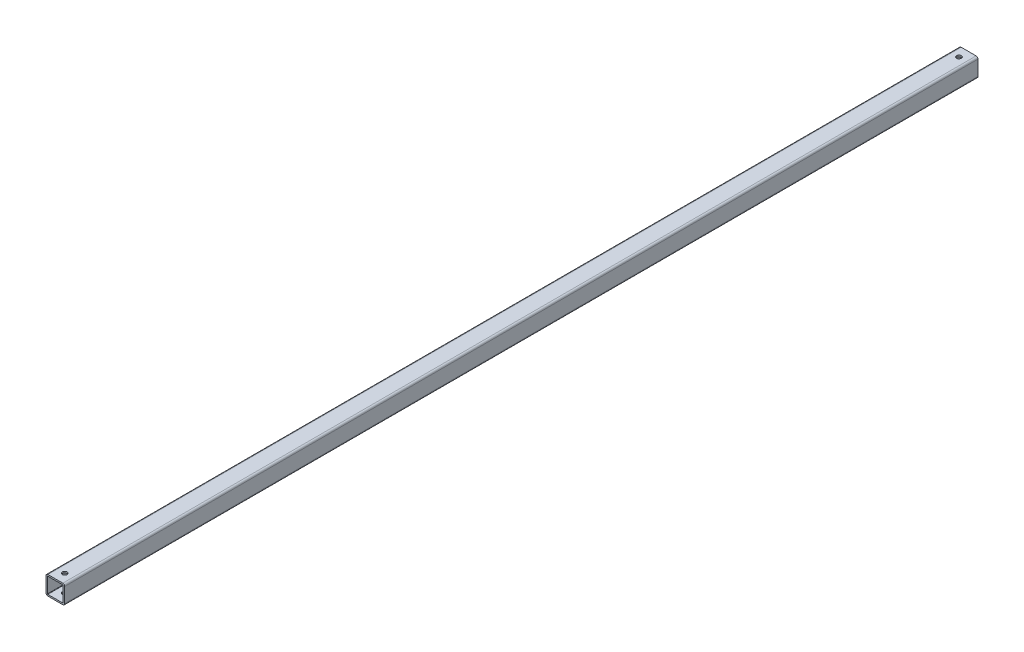
from build123d import *

# Parameters (mm, degrees)
EXTRUDE_THIN1_DEPTH             = 609.6
F_1_4_0_25_DIAMETER_HOLE1_D     = 6.35
F_1_4_0_25_DIAMETER_HOLE1_DEPTH = 25.4
F_1_4_0_25_DIAMETER_HOLE1_TIP   = 1.907732465


with BuildPart() as part:
    # Sketch1 → Extrude-Thin1 (new, symmetric)
    with BuildSketch(Plane.XY):
        with BuildLine():
            Line((-12.5, -10), (-12.5, 10))
            ThreePointArc((-12.5, 10), (-11.767766953, 11.767766953), (-10, 12.5))
            Line((-10, 12.5), (10, 12.5))
            ThreePointArc((10, 12.5), (11.767766953, 11.767766953), (12.5, 10))
            Line((12.5, 10), (12.5, -10))
            ThreePointArc((12.5, -10), (11.767766953, -11.767766953), (10, -12.5))
            Line((10, -12.5), (-10, -12.5))
            ThreePointArc((-10, -12.5), (-11.767766953, -11.767766953), (-12.5, -10))
        make_face()
        with BuildLine():
            Line((-10.5, -10), (-10.5, 10))
            ThreePointArc((-10.5, 10), (-10.353553391, 10.353553391), (-10, 10.5))
            Line((-10, 10.5), (10, 10.5))
            ThreePointArc((10, 10.5), (10.353553391, 10.353553391), (10.5, 10))
            Line((10.5, 10), (10.5, -10))
            ThreePointArc((10.5, -10), (10.353553391, -10.353553391), (10, -10.5))
            Line((10, -10.5), (-10, -10.5))
            ThreePointArc((-10, -10.5), (-10.353553391, -10.353553391), (-10.5, -10))
        make_face(mode=Mode.SUBTRACT)
    extrude(amount=EXTRUDE_THIN1_DEPTH, both=True)

    # 1/4 (0.25) Diameter Hole1
    with Locations(Plane(origin=(0, 12.5, 0), x_dir=(1, 0, 0), z_dir=(0, 1, 0))):
        with Locations((-0.2, 596.9), (-0.2, -596.9)):
            Hole(F_1_4_0_25_DIAMETER_HOLE1_D / 2, depth=F_1_4_0_25_DIAMETER_HOLE1_DEPTH)
            with Locations((0, 0, -(F_1_4_0_25_DIAMETER_HOLE1_DEPTH + F_1_4_0_25_DIAMETER_HOLE1_TIP / 2))):  # 118° drill point
                Cone(0, F_1_4_0_25_DIAMETER_HOLE1_D / 2, F_1_4_0_25_DIAMETER_HOLE1_TIP, mode=Mode.SUBTRACT)


solid = part.part
